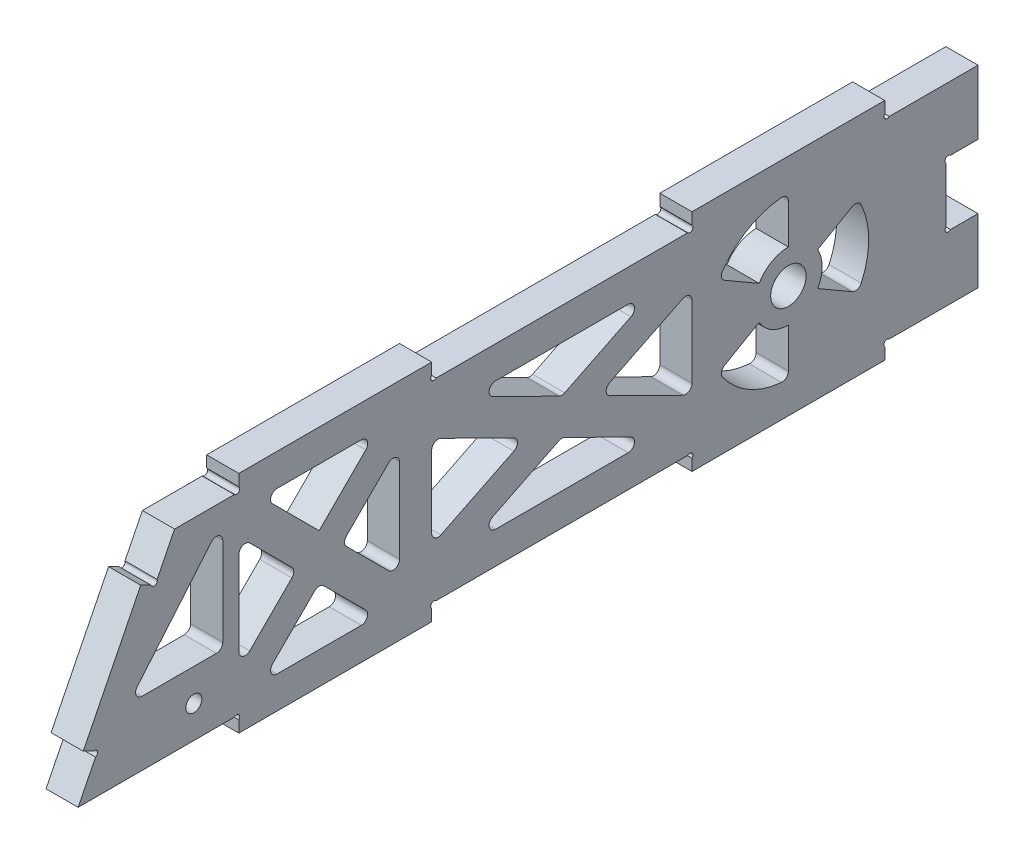
from build123d import *

# Parameters (mm, degrees)
SKETCH1_W               = 355.6
SKETCH1_H               = 76.2
BOSS_EXTRUDE1_DEPTH     = 12.7
CUT_EXTRUDE1_DEPTH      = 183.279291199
CUT_EXTRUDE1_DEPTH_BACK = 183.279291199
SKETCH3_W               = 76.2
SKETCH3_H               = 6.35
BOSS_EXTRUDE2_DEPTH     = 12.7
SKETCH4_W               = 12.7
SKETCH4_H               = 25.4
CUT_EXTRUDE2_DEPTH      = 184.711546997
SKETCH5_R               = 7
CUT_EXTRUDE3_DEPTH      = 184.711546997
CUT_EXTRUDE4_DEPTH      = 184.711546997
BOSS_EXTRUDE3_DEPTH     = 12.7
SKETCH9_R               = 1.27
CUT_EXTRUDE6_DEPTH      = 184.711546997
CUT_EXTRUDE7_DEPTH      = 184.711546997
FILLET1_R               = 2.54
FILLET2_R               = 2.54
SKETCH11_R              = 3.175
CUT_EXTRUDE8_DEPTH      = 184.711546997


with BuildPart() as part:
    # Sketch1 → Boss-Extrude1 (new body)
    with BuildSketch(Plane(origin=(0, 0, 0), x_dir=(0, 0, -1), z_dir=(1, 0, 0))):
        Rectangle(SKETCH1_W, SKETCH1_H)
    extrude(amount=BOSS_EXTRUDE1_DEPTH)

    # Sketch2 → Cut-Extrude1 (cut, two sides: drawn at the far end of the back side and taken through both)
    with BuildSketch(Plane(origin=(12.7, 0, 0), x_dir=(0, 0, -1), z_dir=(1, 0, 0)).offset(-CUT_EXTRUDE1_DEPTH_BACK)):
        Polygon((-507.550847217, -697.601694433), (-177.8, -38.1), (-139.7, 38.1), (190.050847217, 697.601694433), (-1128.95254165, 1357.103388866), (-1826.554236083, -38.1), align=None)
    extrude(amount=CUT_EXTRUDE1_DEPTH + CUT_EXTRUDE1_DEPTH_BACK, mode=Mode.SUBTRACT)

    # Sketch3 → Boss-Extrude2 (add)
    with BuildSketch(Plane.ZY):
        with Locations((-102.87, -41.275)):
            Rectangle(SKETCH3_W, SKETCH3_H)
        with Locations((76.2, -41.275)):
            Rectangle(SKETCH3_W, SKETCH3_H)
        with Locations((-102.87, 41.275)):
            Rectangle(SKETCH3_W, SKETCH3_H)
        with Locations((76.2, 41.275)):
            Rectangle(SKETCH3_W, SKETCH3_H)
    extrude(amount=-BOSS_EXTRUDE2_DEPTH)

    # Sketch4 → Cut-Extrude2 (cut, through all)
    with BuildSketch(Plane.ZY):
        with Locations((-171.45, 0)):
            Rectangle(SKETCH4_W, SKETCH4_H)
    extrude(amount=-CUT_EXTRUDE2_DEPTH, mode=Mode.SUBTRACT)

    # Sketch5 → Cut-Extrude3 (cut, through all)
    with BuildSketch(Plane.ZY):
        with Locations((-102.87, 0)):
            Circle(SKETCH5_R)
    extrude(amount=-CUT_EXTRUDE3_DEPTH, mode=Mode.SUBTRACT)

    # Sketch6 → Cut-Extrude4 (cut, through all)
    with BuildSketch(Plane.ZY):
        Polygon((23.758802297, 25.4), (-50.428802297, 25.4), (-13.335, 7.08207294), align=None)
        Polygon((-27.676197703, 0), (-64.77, 18.31792706), (-64.77, -18.31792706), align=None)
        Polygon((38.1, -18.31792706), (38.1, 18.31792706), (1.006197703, 0), align=None)
        Polygon((-13.335, -7.08207294), (-50.428802297, -25.4), (23.758802297, -25.4), align=None)
        Polygon((105.319743879, 31.75), (59.780256121, 31.75), (82.55, 8.980256121), align=None)
        Polygon((73.569743879, 0), (50.8, 22.769743879), (50.8, -22.769743879), align=None)
        Polygon((114.3, 22.769743879), (91.530256121, 0), (114.3, -22.769743879), align=None)
        Polygon((105.319743879, -31.75), (82.55, -8.980256121), (59.780256121, -31.75), align=None)
    extrude(amount=-CUT_EXTRUDE4_DEPTH, mode=Mode.SUBTRACT)

    # Sketch8 → Boss-Extrude3 (add)
    with BuildSketch(Plane(origin=(12.7, 0, 0), x_dir=(0, 0, -1), z_dir=(1, 0, 0))):
        Polygon((-147.390774674, 22.718450651), (-170.109225326, -22.718450651), (-175.788837989, -19.87864432), (-153.070387337, 25.558256983), align=None)
    extrude(amount=-BOSS_EXTRUDE3_DEPTH)

    # Sketch9 → Cut-Extrude6 (cut, through all)
    with BuildSketch(Plane.ZY):
        with Locations((-165.998025612, 11.801974388)):
            Circle(SKETCH9_R)
        with Locations((-165.998025612, -11.801974388)):
            Circle(SKETCH9_R)
        with Locations((-141.868025612, 38.998025612)):
            Circle(SKETCH9_R)
        with Locations((-141.868025612, -38.998025612)):
            Circle(SKETCH9_R)
        with Locations((-63.871974388, -38.998025612)):
            Circle(SKETCH9_R)
        with Locations((-63.871974388, 38.998025612)):
            Circle(SKETCH9_R)
        with Locations((37.201974388, 38.998025612)):
            Circle(SKETCH9_R)
        with Locations((37.201974388, -38.998025612)):
            Circle(SKETCH9_R)
        with Locations((115.198025612, -38.998025612)):
            Circle(SKETCH9_R)
        with Locations((115.198025612, 38.998025612)):
            Circle(SKETCH9_R)
        with Locations((147.792383937, 23.92327844)):
            Circle(SKETCH9_R)
        with Locations((171.314053114, -23.120059914)):
            Circle(SKETCH9_R)
    extrude(amount=-CUT_EXTRUDE6_DEPTH, mode=Mode.SUBTRACT)

    # Sketch10 → Cut-Extrude7 (cut, through all)
    with BuildSketch(Plane.ZY):
        with BuildLine():
            Line((-130.36630657, -15.875), (-114.431439141, -6.675))
            ThreePointArc((-114.431439141, -6.675), (-116.22, 0), (-114.431439141, 6.675))
            Line((-114.431439141, 6.675), (-130.36630657, 15.875))
            ThreePointArc((-130.36630657, 15.875), (-134.62, 0), (-130.36630657, -15.875))
        make_face()
        with BuildLine():
            ThreePointArc((-91.308560859, -6.675), (-96.195, -11.561439141), (-102.87, -13.35))
            Line((-102.87, -13.35), (-102.87, -31.75))
            ThreePointArc((-102.87, -31.75), (-86.995, -27.49630657), (-75.37369343, -15.875))
            Line((-75.37369343, -15.875), (-91.308560859, -6.675))
        make_face()
        with BuildLine():
            Line((-102.87, 31.75), (-102.87, 13.35))
            ThreePointArc((-102.87, 13.35), (-96.195, 11.561439141), (-91.308560859, 6.675))
            Line((-91.308560859, 6.675), (-75.37369343, 15.875))
            ThreePointArc((-75.37369343, 15.875), (-86.995, 27.49630657), (-102.87, 31.75))
        make_face()
        Polygon((120.65, 31.75), (120.65, -12.7), (158.000484171, -12.7), align=None)
    extrude(amount=-CUT_EXTRUDE7_DEPTH, mode=Mode.SUBTRACT)

    # Fillet1
    fillet1_edges = [part.edges().sort_by_distance(p)[0] for p in [
        (6.35, 15.875, -75.37369343),
        (6.35, 31.75, -102.87),
        (6.35, -31.75, -102.87),
        (6.35, -15.875, -75.37369343),
        (6.35, 15.875, -130.36630657),
        (6.35, -15.875, -130.36630657),
    ]]
    fillet(fillet1_edges, radius=FILLET1_R)

    # Fillet2
    fillet2_edges = [part.edges().sort_by_distance(p)[0] for p in [
        (6.35, 18.31792706, -64.77),
        (6.35, -18.31792706, -64.77),
        (6.35, -25.4, -50.428802297),
        (6.35, -25.4, 23.758802297),
        (6.35, 0, -27.676197703),
        (6.35, 0, 1.006197703),
        (6.35, -7.08207294, -13.335),
        (6.35, 18.31792706, 38.1),
        (6.35, -18.31792706, 38.1),
        (6.35, 7.08207294, -13.335),
        (6.35, 25.4, 23.758802297),
        (6.35, 25.4, -50.428802297),
        (6.35, -31.75, 59.780256121),
        (6.35, -31.75, 105.319743879),
        (6.35, 22.769743879, 50.8),
        (6.35, -22.769743879, 50.8),
        (6.35, -22.769743879, 114.3),
        (6.35, -8.980256121, 82.55),
        (6.35, 22.769743879, 114.3),
        (6.35, 0, 73.569743879),
        (6.35, 31.75, 105.319743879),
        (6.35, 0, 91.530256121),
        (6.35, 31.75, 59.780256121),
        (6.35, -12.7, 120.65),
        (6.35, -12.7, 158.000484171),
        (6.35, 31.75, 120.65),
    ]]
    fillet(fillet2_edges, radius=FILLET2_R)

    # Sketch11 → Cut-Extrude8 (cut, through all)
    with BuildSketch(Plane(origin=(12.7, 0, 0), x_dir=(0, 0, -1), z_dir=(1, 0, 0))):
        with Locations((-132.08, -25.4)):
            Circle(SKETCH11_R)
    extrude(amount=-CUT_EXTRUDE8_DEPTH, mode=Mode.SUBTRACT)


solid = part.part
